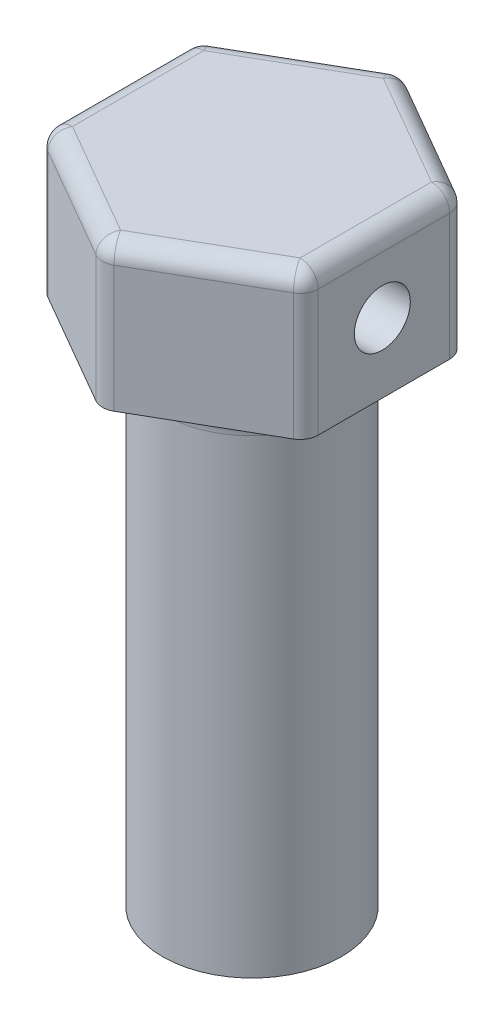
from build123d import *

# Parameters (mm, degrees)
BOSS_EXTRUDE1_DEPTH = 8
SKETCH2_R           = 4.95
BOSS_EXTRUDE2_DEPTH = 28
FILLET1_R           = 2
SKETCH3_R           = 1.55
CUT_EXTRUDE1_DEPTH  = 33.683533061
FILLET2_R           = 1
CUT_EXTRUDE3_START  = -4
SKETCH5_R           = 2.05
CUT_EXTRUDE3_DEPTH  = 4


with BuildPart() as part:
    # Sketch1 → Boss-Extrude1 (new body)
    with BuildSketch(Plane(origin=(0, 0, 0), x_dir=(1, 0, 0), z_dir=(0, 1, 0))):
        Polygon((7.3, -4.214656965), (7.3, 4.214656965), (0, 8.42931393), (-7.3, 4.214656965), (-7.3, -4.214656965), (0, -8.42931393), align=None)
    extrude(amount=BOSS_EXTRUDE1_DEPTH)

    # Sketch2 → Boss-Extrude2 (add)
    with BuildSketch(Plane.XZ):
        Circle(SKETCH2_R)
        with BuildLine():
            Line((-1.55, 1.341640786), (-1.55, -1.341640786))
            ThreePointArc((-1.55, -1.341640786), (2.05, 0), (-1.55, 1.341640786))
        make_face(mode=Mode.SUBTRACT)
    extrude(amount=BOSS_EXTRUDE2_DEPTH)

    # Fillet1
    fillet1_edges = [part.edges().sort_by_distance(p)[0] for p in [
        (-4.95, 0, 0),
    ]]
    fillet(fillet1_edges, radius=FILLET1_R)

    # Sketch3 → Cut-Extrude1 (cut, through all)
    with BuildSketch(Plane(origin=(7.3, 0, 0), x_dir=(0, 0, -1), z_dir=(1, 0, 0))):
        with Locations((-0.085343035, 3.85)):
            Circle(SKETCH3_R)
    extrude(amount=-CUT_EXTRUDE1_DEPTH, mode=Mode.SUBTRACT)

    # Fillet2
    fillet2_edges = [part.edges().sort_by_distance(p)[0] for p in [
        (-3.65, 8, 6.321985448),
        (-7.3, 8, 0),
        (-3.65, 8, -6.321985448),
        (3.65, 8, -6.321985448),
        (7.3, 8, 0),
        (3.65, 8, 6.321985448),
        (-7.3, 4, -4.214656965),
        (0, 4, -8.42931393),
        (7.3, 4, -4.214656965),
        (7.3, 4, 4.214656965),
        (0, 4, 8.42931393),
        (-7.3, 4, 4.214656965),
    ]]
    fillet(fillet2_edges, radius=FILLET2_R)

    # Sketch5 → Cut-Extrude3 (cut)
    with BuildSketch(Plane.XZ.offset(28).offset(CUT_EXTRUDE3_START)):
        Circle(SKETCH5_R)
    extrude(amount=CUT_EXTRUDE3_DEPTH, mode=Mode.SUBTRACT)


solid = part.part
